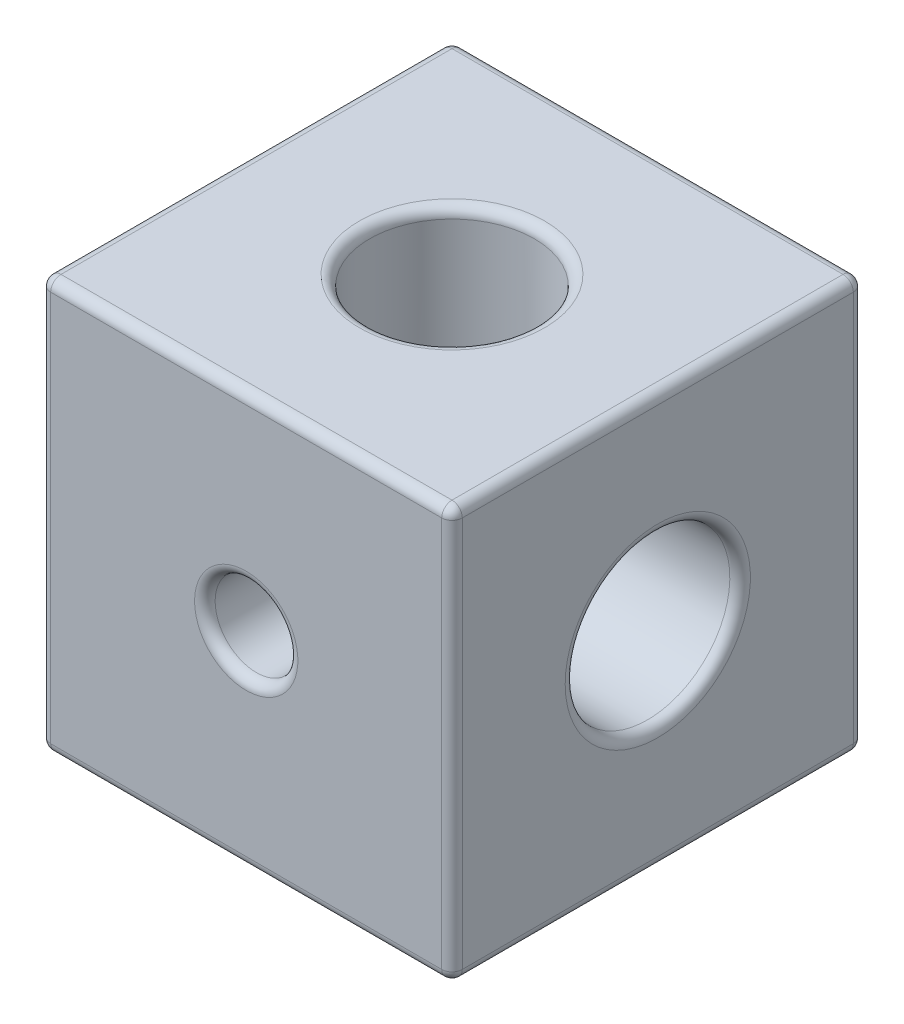
from build123d import *

# Parameters (mm, degrees)
SKETCH1_W                         = 25.4
SKETCH1_H                         = 25.4
BOSS_EXTRUDE1_DEPTH               = 25.4
F_1_4_20_TAPPED_HOLE1_D           = 5.1054
F_1_4_20_TAPPED_HOLE1_ON_FACE_2_D = 5.1054
F_1_4_20_TAPPED_HOLE1_ON_FACE_3_D = 5.1054
SKETCH7_R                         = 5.08
CUT_EXTRUDE1_DEPTH                = 12.7
SKETCH8_R                         = 5.08
CUT_EXTRUDE2_DEPTH                = 12.7
SKETCH10_R                        = 5.08
CUT_EXTRUDE3_DEPTH                = 12.7
FILLET1_R                         = 0.635


with BuildPart() as part:
    # Sketch1 → Boss-Extrude1 (new body)
    with BuildSketch(Plane.XY):
        with Locations((12.7, 12.7)):
            Rectangle(SKETCH1_W, SKETCH1_H)
    extrude(amount=BOSS_EXTRUDE1_DEPTH)

    # 1/4-20 Tapped Hole1 (through all)
    with Locations(Plane(origin=(12.7, 12.7, 25.4), x_dir=(1, 0, 0), z_dir=(0, 0, 1))):
        with Locations((0, 0)):
            Hole(F_1_4_20_TAPPED_HOLE1_D / 2)

    # 1/4-20 Tapped Hole1 on face 2 (through all)
    with Locations(Plane(origin=(25.4, 12.7, 12.7), x_dir=(0, 0, 1), z_dir=(1, 0, 0))):
        with Locations((0, 0)):
            Hole(F_1_4_20_TAPPED_HOLE1_ON_FACE_2_D / 2)

    # 1/4-20 Tapped Hole1 on face 3 (through all)
    with Locations(Plane(origin=(12.7, 25.4, 12.7), x_dir=(0, 0, 1), z_dir=(0, 1, 0))):
        with Locations((0, 0)):
            Hole(F_1_4_20_TAPPED_HOLE1_ON_FACE_3_D / 2)

    # Sketch7 → Cut-Extrude1 (cut)
    with BuildSketch(Plane(origin=(25.4, 0, 0), x_dir=(0, 0, -1), z_dir=(1, 0, 0))):
        with Locations((-12.7, 12.7)):
            Circle(SKETCH7_R)
    extrude(amount=-CUT_EXTRUDE1_DEPTH, mode=Mode.SUBTRACT)

    # Sketch8 → Cut-Extrude2 (cut)
    with BuildSketch(Plane(origin=(0, 0, 0), x_dir=(-1, 0, 0), z_dir=(0, 0, -1))):
        with Locations((-12.7, 12.7)):
            Circle(SKETCH8_R)
    extrude(amount=-CUT_EXTRUDE2_DEPTH, mode=Mode.SUBTRACT)

    # Sketch10 → Cut-Extrude3 (cut)
    with BuildSketch(Plane(origin=(0, 25.4, 0), x_dir=(1, 0, 0), z_dir=(0, 1, 0))):
        with Locations((12.7, -12.7)):
            Circle(SKETCH10_R)
    extrude(amount=-CUT_EXTRUDE3_DEPTH, mode=Mode.SUBTRACT)

    # Fillet1
    fillet1_edges = [part.edges().sort_by_distance(p)[0] for p in [
        (0, 12.7, 15.2527),
        (0, 0, 12.7),
        (12.7, 0, 15.2527),
        (12.7, 0, 0),
        (0, 12.7, 0),
        (17.78, 12.7, 0),
        (25.4, 0, 12.7),
        (25.4, 12.7, 0),
        (25.4, 12.7, 17.78),
        (15.2527, 12.7, 25.4),
        (25.4, 12.7, 25.4),
        (12.7, 0, 25.4),
        (0, 12.7, 25.4),
        (25.4, 25.4, 12.7),
        (12.7, 25.4, 25.4),
        (0, 25.4, 12.7),
        (12.7, 25.4, 0),
        (7.62, 25.4, 12.7),
    ]]
    fillet(fillet1_edges, radius=FILLET1_R)


solid = part.part
